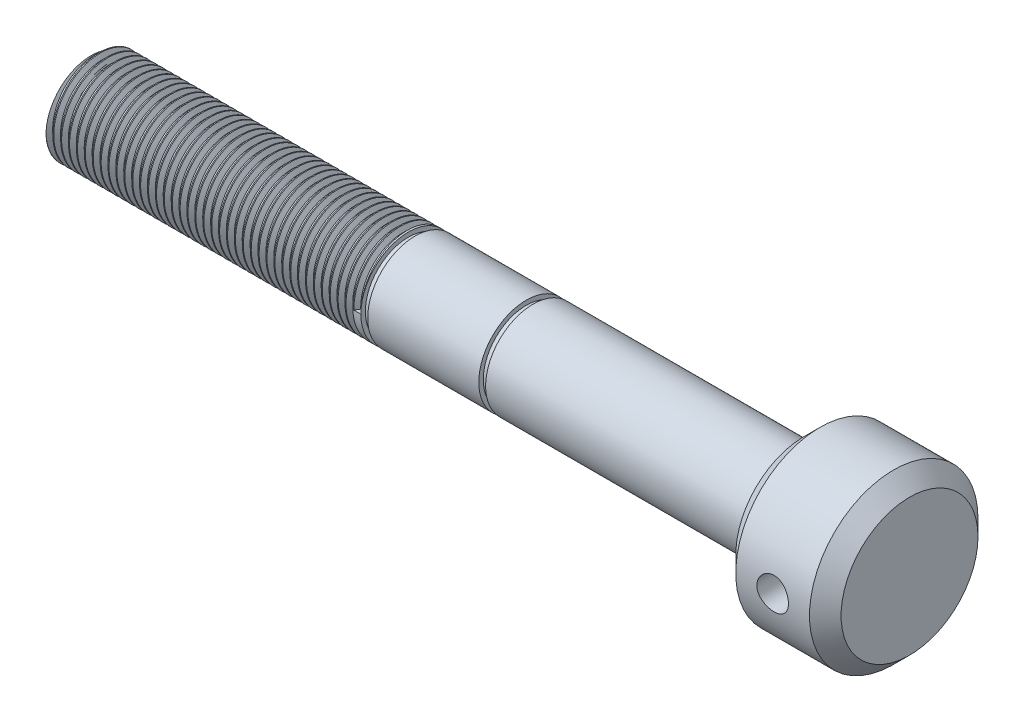
from build123d import *

# Parameters (mm, degrees)
SCHIZZO1_R                    = 16
ESTRUSIONE_ESTRUSIONE1_DEPTH  = 20
TAGLIO_ESTRUSIONE1_DEPTH      = 31.199337741
TAGLIO_ESTRUSIONE1_DEPTH_BACK = 31.199337741
SCHIZZO2_R                    = 3
SCHIZZO3_R                    = 9
ESTRUSIONE_ESTRUSIONE2_DEPTH  = 135
SCHIZZO4_W                    = 1.3
SCHIZZO4_H                    = 0.85
SMUSSO1_SIZE                  = 3
FILETTATURA1_PITCH            = 1.5


with BuildPart() as part:
    # Schizzo1 → Estrusione-Estrusione1 (new body)
    with BuildSketch(Plane(origin=(0, 0, 0), x_dir=(0, 0, -1), z_dir=(1, 0, 0))):
        Circle(SCHIZZO1_R)
    extrude(amount=ESTRUSIONE_ESTRUSIONE1_DEPTH)

    # Schizzo2 → Taglio-Estrusione1 (cut, two sides: drawn at the far end of the back side and taken through both)
    with BuildSketch(Plane.XY.offset(-TAGLIO_ESTRUSIONE1_DEPTH_BACK)):
        with Locations((10, 0)):
            Circle(SCHIZZO2_R)
    extrude(amount=TAGLIO_ESTRUSIONE1_DEPTH + TAGLIO_ESTRUSIONE1_DEPTH_BACK, mode=Mode.SUBTRACT)

    # Schizzo3 → Estrusione-Estrusione2 (add)
    with BuildSketch(Plane(origin=(0, 0, 0), x_dir=(0, 0, -1), z_dir=(1, 0, 0))):
        Circle(SCHIZZO3_R)
    extrude(amount=-ESTRUSIONE_ESTRUSIONE2_DEPTH)

    # Schizzo4 → Taglia-Rivoluzione1 (revolve, cut)
    with BuildSketch(Plane.XY, mode=Mode.PRIVATE) as taglia_rivoluzione1_sk:
        with Locations((-52.15, 8.575)):
            Rectangle(SCHIZZO4_W, SCHIZZO4_H)
        with Locations((-74.55, 8.575)):
            Rectangle(SCHIZZO4_W, SCHIZZO4_H)
    revolve(taglia_rivoluzione1_sk.sketch.rotate(Axis((0, 0, 0), (-1, 0, 0)), 90), axis=Axis((0, 0, 0), (-1, 0, 0)), mode=Mode.SUBTRACT)

    # Smusso1
    smusso1_edges = [part.edges().sort_by_distance(p)[0] for p in [
        (0, 0, 16),
        (20, 0, 16),
    ]]
    chamfer(smusso1_edges, length=SMUSSO1_SIZE)

    # Filettatura1: arcs per turn and ends read off the stored shape
    # Filettatura1: the profile of Profilo filettatura1 profile screwed along a right-hand helix through 39.866667 turns, 8 arcs to a turn; built about Z, then put on its axis
    filettatura1_z = Axis((0, 0, 0), (0, 0, 1))
    filettatura1_corners = [(9.0003, 0, -0.000173205), (9.0003, 0, 1.312673201), (8.188101187, 0, 0.843749998), (8.188101187, 0, 0.468749998)]
    with BuildLine(mode=Mode.PRIVATE) as filettatura1_profile:
        Line(filettatura1_corners[0], filettatura1_corners[1])
        Line(filettatura1_corners[1], filettatura1_corners[2])
        Line(filettatura1_corners[2], filettatura1_corners[3])
        Line(filettatura1_corners[3], filettatura1_corners[0])
    filettatura1_cap = Face(filettatura1_profile.wire())
    filettatura1_turn_angles = [0, 22.5, 45, 67.5, 90, 112.5, 135, 157.5, 180, 202.5, 225, 247.5, 270, 292.5, 315, 337.5, 360]
    filettatura1_turn_weights = [1, 0.9238795325112867, 1, 0.9238795325112867, 1, 0.9238795325112867, 1, 0.9238795325112867, 1, 0.9238795325112867, 1, 0.9238795325112867, 1, 0.9238795325112867, 1, 0.9238795325112867, 1]
    filettatura1_turn_rails = [Edge.make_bspline([Vector(p[0], p[1], 0).rotate(filettatura1_z, filettatura1_turn_angles[k]) / filettatura1_turn_weights[k] + Vector(0, 0, p[2] + FILETTATURA1_PITCH * filettatura1_turn_angles[k] / 360) for k in range(17)], [0, 0, 0, 1, 1, 2, 2, 3, 3, 4, 4, 5, 5, 6, 6, 7, 7, 8, 8, 8], 2, filettatura1_turn_weights) for p in filettatura1_corners]
    filettatura1_turn_sides = [Face.make_surface_from_curves(filettatura1_turn_rails[p[0]], filettatura1_turn_rails[p[1]]) for p in [(0, 1), (1, 2), (2, 3), (3, 0)]]
    filettatura1_last_angles = [14040, 14062.5, 14085, 14107.5, 14130, 14152.5, 14175, 14197.5, 14220, 14242.5, 14265, 14287.5, 14310, 14331, 14352]
    filettatura1_last_weights = [1, 0.9238795325112867, 1, 0.9238795325112867, 1, 0.9238795325112867, 1, 0.9238795325112867, 1, 0.9238795325112867, 1, 0.9238795325112867, 1, 0.9335804264971961, 1]
    filettatura1_last_rails = [Edge.make_bspline([Vector(p[0], p[1], 0).rotate(filettatura1_z, filettatura1_last_angles[k]) / filettatura1_last_weights[k] + Vector(0, 0, p[2] + FILETTATURA1_PITCH * filettatura1_last_angles[k] / 360) for k in range(15)], [0, 0, 0, 1, 1, 2, 2, 3, 3, 4, 4, 5, 5, 6, 6, 7, 7, 7], 2, filettatura1_last_weights) for p in filettatura1_corners]
    filettatura1_last_sides = [Face.make_surface_from_curves(filettatura1_last_rails[p[0]], filettatura1_last_rails[p[1]]) for p in [(0, 1), (1, 2), (2, 3), (3, 0)]]
    filettatura1 = Plane(origin=(-75.2, 0, 0), x_dir=(0, 0, 1), z_dir=(-1, 0, 0)) * Solid(Shell([*[p.moved(Location((0, 0, FILETTATURA1_PITCH * i))) for i in range(39) for p in filettatura1_turn_sides], *filettatura1_last_sides, filettatura1_cap, filettatura1_cap.rotate(filettatura1_z, 14352).moved(Location((0, 0, FILETTATURA1_PITCH * 14352 / 360)))]))
    add(filettatura1, mode=Mode.SUBTRACT)


solid = part.part
